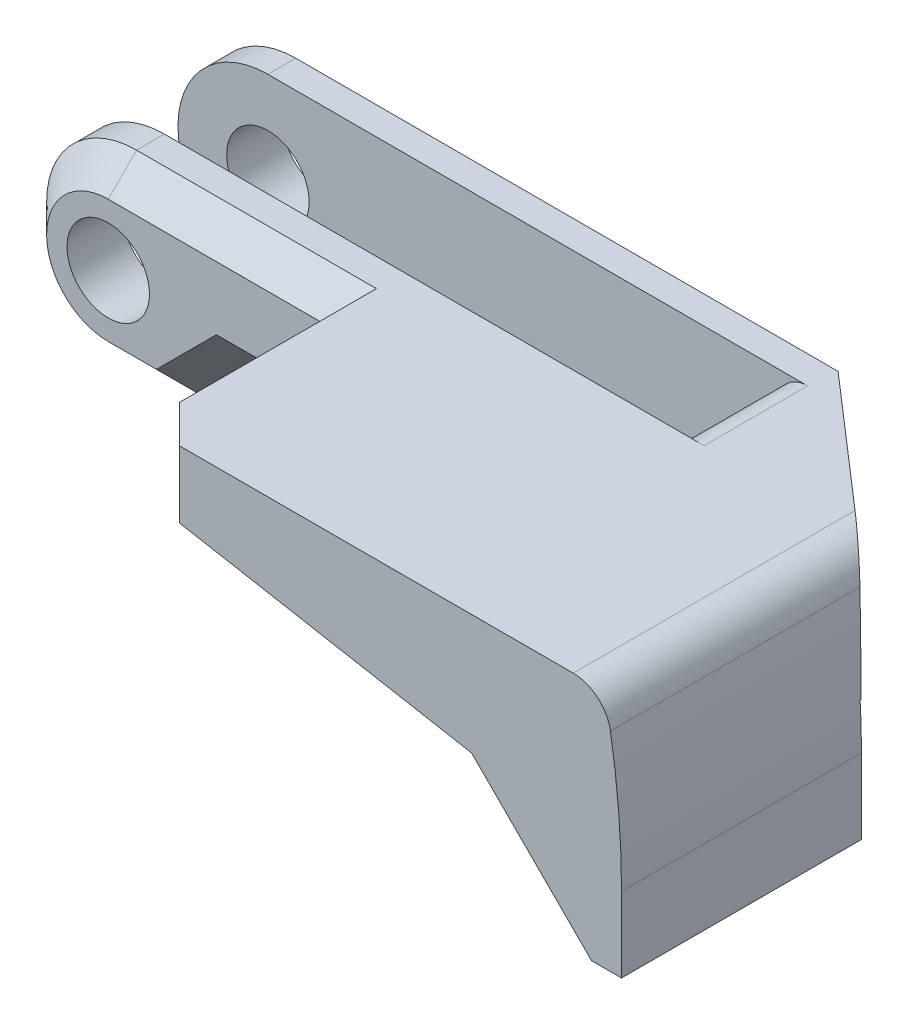
from build123d import *

# Parameters (mm, degrees)
BOSS_EXTRUDE1_DEPTH              = 11.43
BOSS_EXTRUDE2_DEPTH              = 12.7
SKETCH3_W                        = 11.43
SKETCH3_H                        = 6.35
CUT_EXTRUDE1_DEPTH               = 12.7
F_11_64_0_17188_DIAMETER_HOLE1_D = 4.365752
FILLET5_R                        = 2
BOSS_EXTRUDE3_START              = 1.778
BOSS_EXTRUDE3_DEPTH              = 1.778
CUT_EXTRUDE8_DEPTH               = 41.937805342
CUT_EXTRUDE9_DEPTH               = 1.778
CUT_EXTRUDE10_DEPTH              = 46.962070275
SKETCH16_W                       = 31.75
SKETCH16_H                       = 5.48
CUT_EXTRUDE11_DEPTH              = 46.962070275
FILLET7_R                        = 1.5875
F_1_8_0_125_DIAMETER_HOLE1_D     = 3.175
F_1_8_0_125_DIAMETER_HOLE1_DEPTH = 19.05
F_1_8_0_125_DIAMETER_HOLE1_TIP   = 0.953866233
CHAMFER6_SIZE                    = 2


with BuildPart() as part:
    # Sketch1 → Boss-Extrude1 (new body)
    with BuildSketch(Plane.XY):
        with BuildLine():
            Line((0, -4.7625), (3.175, -4.7625))
            Line((3.175, -4.7625), (6.35, -1.5875))
            Line((6.35, -1.5875), (30.1625, -1.5875))
            Line((30.1625, -1.5875), (36.5125, -7.9375))
            Line((36.5125, -7.9375), (38.1, -7.9375))
            Line((38.1, -7.9375), (38.1, 4.7625))
            Line((38.1, 4.7625), (0, 4.7625))
            ThreePointArc((0, 4.7625), (-4.7625, 0), (0, -4.7625))
        make_face()
    extrude(amount=BOSS_EXTRUDE1_DEPTH)

    # Sketch2 → Boss-Extrude2 (add)
    with BuildSketch(Plane.XY.offset(11.43)):
        with BuildLine():
            ThreePointArc((38.1, -3.96875), (37.874729062, 0.419940487), (37.201284144, 4.7625))
            Line((37.201284144, 4.7625), (12.7, 4.7625))
            Line((12.7, 4.7625), (12.7, 1.5875))
            Line((12.7, 1.5875), (30.1625, -1.5875))
            Line((30.1625, -1.5875), (36.5125, -7.9375))
            Line((36.5125, -7.9375), (38.1, -7.9375))
            Line((38.1, -7.9375), (38.1, -3.96875))
        make_face()
    extrude(amount=BOSS_EXTRUDE2_DEPTH)

    # Sketch3 → Cut-Extrude1 (cut)
    with BuildSketch(Plane(origin=(38.1, 0, 0), x_dir=(0, 0, -1), z_dir=(1, 0, 0))):
        with Locations((-5.715, -4.7625)):
            Rectangle(SKETCH3_W, SKETCH3_H)
    extrude(amount=-CUT_EXTRUDE1_DEPTH, mode=Mode.SUBTRACT)

    # 11/64 (0.17188) Diameter Hole1 (through all)
    with Locations(Plane.XY.offset(11.43)):
        with Locations((0, 0)):
            Hole(F_11_64_0_17188_DIAMETER_HOLE1_D / 2)

    # Fillet5
    fillet5_edges = [part.edges().sort_by_distance(p)[0] for p in [
        (37.201284144, 4.7625, 17.78),
    ]]
    fillet(fillet5_edges, radius=FILLET5_R)

    # Chamfer5
    # the kernel refuses this chamfer: 1.5 mm, written as the material it takes off along each edge
    with BuildSketch(Plane(origin=(0.44731828, -7.49018172, 11.43), x_dir=(0.019442520806014003, -0.019442520806014, -0.9996219169112968), z_dir=(0.7071067811865475, 0.7071067811865477, 0))) as chamfer5_piece_1_section:
        with BuildLine():
            Line((1.543009793, 0), (-0.084820732, 1.54067669))
            Line((-0.084820732, 1.54067669), (-0.11480939, 1.539851814))
            ThreePointArc((-0.11480939, 1.539851814), (-0.051193841, 0.770096744), (-0.029988658, -0.000824876))
            Line((-0.029988658, -0.000824876), (0.000824876, -0.029988658))
            ThreePointArc((0.000824876, -0.029988658), (0.771746497, -0.008783474), (1.543834669, -0.029988658))
            Line((1.543834669, -0.029988658), (1.543009793, 0))
        make_face()
    chamfer5_piece_1 = extrude(amount=12.205177024, mode=Mode.PRIVATE)
    chamfer5_piece_1 = split(chamfer5_piece_1, bisect_by=Plane(origin=(4.06290207, -1.5875, 10.93530956), z_dir=(0, -1, 0)), keep=Keep.TOP, mode=Mode.PRIVATE)
    chamfer5_piece_1 = split(chamfer5_piece_1, bisect_by=Plane(origin=(4.06290207, -4.7625, 10.93530956), z_dir=(0, 1, 0)), keep=Keep.TOP, mode=Mode.PRIVATE)
    add(chamfer5_piece_1, mode=Mode.SUBTRACT)
    with BuildSketch(Plane(origin=(0, -4.7625, 0), x_dir=(0, -0.027495876610586202, 0.9996219169112968), z_dir=(1, 0, 0))) as chamfer5_piece_2_section:
        with BuildLine():
            Line((1.543009793, 0), (-0.084820732, -1.54067669))
            Line((-0.084820732, -1.54067669), (-0.11480939, -1.539851814))
            ThreePointArc((-0.11480939, -1.539851814), (-0.051193841, -0.770096744), (-0.029988658, 0.000824876))
            Line((-0.029988658, 0.000824876), (0.000824876, 0.029988658))
            ThreePointArc((0.000824876, 0.029988658), (0.771746497, 0.008783474), (1.543834669, 0.029988658))
            Line((1.543834669, 0.029988658), (1.543009793, 0))
        make_face()
    chamfer5_piece_2 = extrude(amount=7.032524482, mode=Mode.PRIVATE)
    chamfer5_piece_2 = split(chamfer5_piece_2, bisect_by=Plane(origin=(2.781469351, -5.156030649, 0.473875429), z_dir=(-0.7071067811865477, 0.7071067811865475, 0)), keep=Keep.TOP, mode=Mode.PRIVATE)
    add(chamfer5_piece_2, mode=Mode.SUBTRACT)
    with BuildSketch(Plane(origin=(0, 0, 0), x_dir=(0, 1, 0), z_dir=(1, 0, 0))) as chamfer5_piece_3:
        with BuildLine():
            Line((3.220073593, -0.042426407), (4.804926407, 1.542426407))
            Line((4.804926407, 1.542426407), (4.834926407, 1.542426407))
            ThreePointArc((4.834926407, 1.542426407), (4.7925, 0.771213203), (4.7925, 0))
            Line((4.7925, 0), (4.7625, -0.03))
            ThreePointArc((4.7625, -0.03), (3.991286797, -0.03), (3.220073593, -0.072426407))
            Line((3.220073593, -0.072426407), (3.220073593, -0.042426407))
        make_face()
    revolve(axis=Axis((0, 0, 0), (0, 0, 1)), revolution_arc=180, mode=Mode.SUBTRACT)
    with BuildSketch(Plane(origin=(2.492475518, -1.5875, 11.43), x_dir=(0, -0.027495876610586334, -0.9996219169112968), z_dir=(1, 0, 0))) as chamfer5_piece_4_section:
        with BuildLine():
            Line((1.543009793, 0), (-0.084820732, 1.54067669))
            Line((-0.084820732, 1.54067669), (-0.11480939, 1.539851814))
            ThreePointArc((-0.11480939, 1.539851814), (-0.051193841, 0.770096744), (-0.029988658, -0.000824876))
            Line((-0.029988658, -0.000824876), (0.000824876, -0.029988658))
            ThreePointArc((0.000824876, -0.029988658), (0.771746497, -0.008783474), (1.543834669, -0.029988658))
            Line((1.543834669, -0.029988658), (1.543009793, 0))
        make_face()
    chamfer5_piece_4 = extrude(amount=31.527548964, mode=Mode.PRIVATE)
    chamfer5_piece_4 = split(chamfer5_piece_4, bisect_by=Plane(origin=(17.615702577, 0.693735895, 10.888791896), z_dir=(-0.178885438199983, -0.9838699100999075, 0)), keep=Keep.TOP, mode=Mode.PRIVATE)
    chamfer5_piece_4 = split(chamfer5_piece_4, bisect_by=Plane(origin=(17.279834664, -1.153537628, 11.43), z_dir=(0, 0, -1)), keep=Keep.TOP, mode=Mode.PRIVATE)
    chamfer5_piece_4 = split(chamfer5_piece_4, bisect_by=Plane(origin=(12.031898518, 4.094398518, 10.888791896), z_dir=(0.7071067811865477, -0.7071067811865475, 0)), keep=Keep.TOP, mode=Mode.PRIVATE)
    add(chamfer5_piece_4, mode=Mode.SUBTRACT)
    with BuildSketch(Plane(origin=(12.7, 4.7625, 11.43), x_dir=(0, 0.02749587661058619, -0.9996219169112968), z_dir=(-1, 0, 0))) as chamfer5_piece_5:
        with BuildLine():
            Line((1.543009793, 0), (-0.084820732, 1.54067669))
            Line((-0.084820732, 1.54067669), (-0.11480939, 1.539851814))
            ThreePointArc((-0.11480939, 1.539851814), (-0.051193841, 0.770096744), (-0.029988658, -0.000824876))
            Line((-0.029988658, -0.000824876), (0.000824876, -0.029988658))
            ThreePointArc((0.000824876, -0.029988658), (0.771746497, -0.008783474), (1.543834669, -0.029988658))
            Line((1.543834669, -0.029988658), (1.543009793, 0))
        make_face()
    extrude(amount=12.7, mode=Mode.SUBTRACT)
    with BuildSketch(Plane(origin=(0, 0, 11.43), x_dir=(0, 1, 0), z_dir=(1, 0, 0))) as chamfer5_piece_6:
        with BuildLine():
            Line((4.804926407, -1.542426407), (3.220073593, 0.042426407))
            Line((3.220073593, 0.042426407), (3.220073593, 0.072426407))
            ThreePointArc((3.220073593, 0.072426407), (3.991286797, 0.03), (4.7625, 0.03))
            Line((4.7625, 0.03), (4.7925, 0))
            ThreePointArc((4.7925, 0), (4.7925, -0.771213203), (4.834926407, -1.542426407))
            Line((4.834926407, -1.542426407), (4.804926407, -1.542426407))
        make_face()
    revolve(axis=Axis((0, 0, 11.43), (0, 0, 1)), revolution_arc=180, mode=Mode.SUBTRACT)
    with BuildSketch(Plane(origin=(0, -4.7625, 11.43), x_dir=(0, -0.02749587661058619, -0.9996219169112968), z_dir=(1, 0, 0))) as chamfer5_piece_7_section:
        with BuildLine():
            Line((1.543009793, 0), (-0.084820732, 1.54067669))
            Line((-0.084820732, 1.54067669), (-0.11480939, 1.539851814))
            ThreePointArc((-0.11480939, 1.539851814), (-0.051193841, 0.770096744), (-0.029988658, -0.000824876))
            Line((-0.029988658, -0.000824876), (0.000824876, -0.029988658))
            ThreePointArc((0.000824876, -0.029988658), (0.771746497, -0.008783474), (1.543834669, -0.029988658))
            Line((1.543834669, -0.029988658), (1.543009793, 0))
        make_face()
    chamfer5_piece_7 = extrude(amount=7.032524482, mode=Mode.PRIVATE)
    chamfer5_piece_7 = split(chamfer5_piece_7, bisect_by=Plane(origin=(2.781469351, -5.156030649, 10.956124571), z_dir=(-0.7071067811865477, 0.7071067811865475, 0)), keep=Keep.TOP, mode=Mode.PRIVATE)
    add(chamfer5_piece_7, mode=Mode.SUBTRACT)
    with BuildSketch(Plane(origin=(38.1, 4.7625, 0), x_dir=(0, 0.027495876610586202, 0.9996219169112968), z_dir=(-1, 0, 0))) as chamfer5_piece_8:
        with BuildLine():
            Line((1.543009793, 0), (-0.084820732, -1.54067669))
            Line((-0.084820732, -1.54067669), (-0.11480939, -1.539851814))
            ThreePointArc((-0.11480939, -1.539851814), (-0.051193841, -0.770096744), (-0.029988658, 0.000824876))
            Line((-0.029988658, 0.000824876), (0.000824876, 0.029988658))
            ThreePointArc((0.000824876, 0.029988658), (0.771746497, 0.008783474), (1.543834669, 0.029988658))
            Line((1.543834669, 0.029988658), (1.543009793, 0))
        make_face()
    extrude(amount=38.1, mode=Mode.SUBTRACT)
    with BuildSketch(Plane(origin=(0.44731828, -7.49018172, 11.43), x_dir=(0.019442520806014003, -0.019442520806014, -0.9996219169112968), z_dir=(0.7071067811865475, 0.7071067811865477, 0))) as chamfer5_piece_9a_section:
        with BuildLine():
            Line((1.543009793, 0), (-0.084820732, 1.54067669))
            Line((-0.084820732, 1.54067669), (-0.11480939, 1.539851814))
            ThreePointArc((-0.11480939, 1.539851814), (-0.051193841, 0.770096744), (-0.029988658, -0.000824876))
            Line((-0.029988658, -0.000824876), (0.000824876, -0.029988658))
            ThreePointArc((0.000824876, -0.029988658), (0.771746497, -0.008783474), (1.543834669, -0.029988658))
            Line((1.543834669, -0.029988658), (1.543009793, 0))
        make_face()
    chamfer5_piece_9a = extrude(amount=12.205177024, mode=Mode.PRIVATE)
    chamfer5_piece_9a = split(chamfer5_piece_9a, bisect_by=Plane(origin=(1.331526221, -4.7625, 10.912595192), z_dir=(0, -1, 0)), keep=Keep.TOP, mode=Mode.PRIVATE)
    with BuildSketch(Plane(origin=(0, -4.7625, 11.43), x_dir=(0, -0.02749587661058619, -0.9996219169112968), z_dir=(1, 0, 0))) as chamfer5_piece_9b_section:
        with BuildLine():
            Line((1.543009793, 0), (-0.084820732, 1.54067669))
            Line((-0.084820732, 1.54067669), (-0.11480939, 1.539851814))
            ThreePointArc((-0.11480939, 1.539851814), (-0.051193841, 0.770096744), (-0.029988658, -0.000824876))
            Line((-0.029988658, -0.000824876), (0.000824876, -0.029988658))
            ThreePointArc((0.000824876, -0.029988658), (0.771746497, -0.008783474), (1.543834669, -0.029988658))
            Line((1.543834669, -0.029988658), (1.543009793, 0))
        make_face()
    chamfer5_piece_9b = extrude(amount=7.032524482, mode=Mode.PRIVATE)
    chamfer5_piece_9b = split(chamfer5_piece_9b, bisect_by=Plane(origin=(4.47853281, -3.45896719, 10.912595192), z_dir=(0.7071067811865477, -0.7071067811865475, 0)), keep=Keep.TOP, mode=Mode.PRIVATE)
    chamfer5_piece_9 = chamfer5_piece_9a & chamfer5_piece_9b
    add(chamfer5_piece_9, mode=Mode.SUBTRACT)
    with BuildSketch(Plane(origin=(2.492475518, -1.5875, 11.43), x_dir=(0, -0.027495876610586334, -0.9996219169112968), z_dir=(1, 0, 0))) as chamfer5_piece_10a_section:
        with BuildLine():
            Line((1.543009793, 0), (-0.084820732, 1.54067669))
            Line((-0.084820732, 1.54067669), (-0.11480939, 1.539851814))
            ThreePointArc((-0.11480939, 1.539851814), (-0.051193841, 0.770096744), (-0.029988658, -0.000824876))
            Line((-0.029988658, -0.000824876), (0.000824876, -0.029988658))
            ThreePointArc((0.000824876, -0.029988658), (0.771746497, -0.008783474), (1.543834669, -0.029988658))
            Line((1.543834669, -0.029988658), (1.543009793, 0))
        make_face()
    chamfer5_piece_10a = extrude(amount=31.527548964, mode=Mode.PRIVATE)
    chamfer5_piece_10a = split(chamfer5_piece_10a, bisect_by=Plane(origin=(4.673984199, -1.082007119, 11.43), z_dir=(0, 0, -1)), keep=Keep.TOP, mode=Mode.PRIVATE)
    chamfer5_piece_10a = split(chamfer5_piece_10a, bisect_by=Plane(origin=(5.76473854, -2.17276146, 10.926543667), z_dir=(-0.7071067811865477, 0.7071067811865475, 0)), keep=Keep.TOP, mode=Mode.PRIVATE)
    with BuildSketch(Plane(origin=(0.44731828, -7.49018172, 11.43), x_dir=(0.019442520806014003, -0.019442520806014, -0.9996219169112968), z_dir=(0.7071067811865475, 0.7071067811865477, 0))) as chamfer5_piece_10b_section:
        with BuildLine():
            Line((1.543009793, 0), (-0.084820732, 1.54067669))
            Line((-0.084820732, 1.54067669), (-0.11480939, 1.539851814))
            ThreePointArc((-0.11480939, 1.539851814), (-0.051193841, 0.770096744), (-0.029988658, -0.000824876))
            Line((-0.029988658, -0.000824876), (0.000824876, -0.029988658))
            ThreePointArc((0.000824876, -0.029988658), (0.771746497, -0.008783474), (1.543834669, -0.029988658))
            Line((1.543834669, -0.029988658), (1.543009793, 0))
        make_face()
    chamfer5_piece_10b = extrude(amount=12.205177024, mode=Mode.PRIVATE)
    chamfer5_piece_10b = split(chamfer5_piece_10b, bisect_by=Plane(origin=(7.154321547, -1.5875, 10.952860313), z_dir=(0, 1, 0)), keep=Keep.TOP, mode=Mode.PRIVATE)
    chamfer5_piece_10 = chamfer5_piece_10a & chamfer5_piece_10b
    add(chamfer5_piece_10, mode=Mode.SUBTRACT)
    with BuildSketch(Plane(origin=(2.492475518, -1.5875, 11.43), x_dir=(0, -0.027495876610586334, -0.9996219169112968), z_dir=(1, 0, 0))) as chamfer5_piece_11a_section:
        with BuildLine():
            Line((1.543009793, 0), (-0.084820732, 1.54067669))
            Line((-0.084820732, 1.54067669), (-0.11480939, 1.539851814))
            ThreePointArc((-0.11480939, 1.539851814), (-0.051193841, 0.770096744), (-0.029988658, -0.000824876))
            Line((-0.029988658, -0.000824876), (0.000824876, -0.029988658))
            ThreePointArc((0.000824876, -0.029988658), (0.771746497, -0.008783474), (1.543834669, -0.029988658))
            Line((1.543834669, -0.029988658), (1.543009793, 0))
        make_face()
    chamfer5_piece_11a = extrude(amount=31.527548964, mode=Mode.PRIVATE)
    chamfer5_piece_11a = split(chamfer5_piece_11a, bisect_by=Plane(origin=(4.893812688, -0.642350142, 11.43), z_dir=(0, 0, 1)), keep=Keep.TOP, mode=Mode.PRIVATE)
    chamfer5_piece_11a = split(chamfer5_piece_11a, bisect_by=Plane(origin=(6.094481273, -1.843018727, 11.451821906), z_dir=(-0.7071067811865477, 0.7071067811865475, 0)), keep=Keep.TOP, mode=Mode.PRIVATE)
    with BuildSketch(Plane(origin=(0.44731828, -7.49018172, 11.43), x_dir=(0.019442520806014003, -0.019442520806014, -0.9996219169112968), z_dir=(0.7071067811865475, 0.7071067811865477, 0))) as chamfer5_piece_11b_section:
        with BuildLine():
            Line((1.543009793, 0), (-0.084820732, 1.54067669))
            Line((-0.084820732, 1.54067669), (-0.11480939, 1.539851814))
            ThreePointArc((-0.11480939, 1.539851814), (-0.051193841, 0.770096744), (-0.029988658, -0.000824876))
            Line((-0.029988658, -0.000824876), (0.000824876, -0.029988658))
            ThreePointArc((0.000824876, -0.029988658), (0.771746497, -0.008783474), (1.543834669, -0.029988658))
            Line((1.543834669, -0.029988658), (1.543009793, 0))
        make_face()
    chamfer5_piece_11b = extrude(amount=12.205177024, mode=Mode.PRIVATE)
    chamfer5_piece_11b = split(chamfer5_piece_11b, bisect_by=Plane(origin=(7.154321547, -1.5875, 10.952860313), z_dir=(0, 1, 0)), keep=Keep.TOP, mode=Mode.PRIVATE)
    chamfer5_piece_11 = chamfer5_piece_11a & chamfer5_piece_11b
    add(chamfer5_piece_11, mode=Mode.SUBTRACT)
    with BuildSketch(Plane(origin=(2.492475518, -1.5875, 11.43), x_dir=(0, -0.027495876610586334, -0.9996219169112968), z_dir=(1, 0, 0))) as chamfer5_piece_12a_section:
        with BuildLine():
            Line((1.543009793, 0), (-0.084820732, 1.54067669))
            Line((-0.084820732, 1.54067669), (-0.11480939, 1.539851814))
            ThreePointArc((-0.11480939, 1.539851814), (-0.051193841, 0.770096744), (-0.029988658, -0.000824876))
            Line((-0.029988658, -0.000824876), (0.000824876, -0.029988658))
            ThreePointArc((0.000824876, -0.029988658), (0.771746497, -0.008783474), (1.543834669, -0.029988658))
            Line((1.543834669, -0.029988658), (1.543009793, 0))
        make_face()
    chamfer5_piece_12a = extrude(amount=31.527548964, mode=Mode.PRIVATE)
    chamfer5_piece_12a = split(chamfer5_piece_12a, bisect_by=Plane(origin=(16.694095018, 0.861300906, 11.44990258), z_dir=(-0.178885438199983, -0.9838699100999075, 0)), keep=Keep.TOP, mode=Mode.PRIVATE)
    chamfer5_piece_12a = split(chamfer5_piece_12a, bisect_by=Plane(origin=(16.398943836, -0.762030594, 11.43), z_dir=(0, 0, 1)), keep=Keep.TOP, mode=Mode.PRIVATE)
    chamfer5_piece_12a = split(chamfer5_piece_12a, bisect_by=Plane(origin=(11.787206621, 3.849706621, 11.44990258), z_dir=(0.7071067811865477, -0.7071067811865475, 0)), keep=Keep.TOP, mode=Mode.PRIVATE)
    with BuildSketch(Plane(origin=(0.44731828, -7.49018172, 11.43), x_dir=(0.019442520806014003, -0.019442520806014, -0.9996219169112968), z_dir=(0.7071067811865475, 0.7071067811865477, 0))) as chamfer5_piece_12b_section:
        with BuildLine():
            Line((1.543009793, 0), (-0.084820732, 1.54067669))
            Line((-0.084820732, 1.54067669), (-0.11480939, 1.539851814))
            ThreePointArc((-0.11480939, 1.539851814), (-0.051193841, 0.770096744), (-0.029988658, -0.000824876))
            Line((-0.029988658, -0.000824876), (0.000824876, -0.029988658))
            ThreePointArc((0.000824876, -0.029988658), (0.771746497, -0.008783474), (1.543834669, -0.029988658))
            Line((1.543834669, -0.029988658), (1.543009793, 0))
        make_face()
    chamfer5_piece_12b = extrude(amount=12.205177024, mode=Mode.PRIVATE)
    chamfer5_piece_12b = split(chamfer5_piece_12b, bisect_by=Plane(origin=(7.154321547, -1.5875, 10.952860313), z_dir=(0, 1, 0)), keep=Keep.TOP, mode=Mode.PRIVATE)
    chamfer5_piece_12 = chamfer5_piece_12a & chamfer5_piece_12b
    add(chamfer5_piece_12, mode=Mode.SUBTRACT)

    # Sketch12 → Boss-Extrude3 (add)
    with BuildSketch(Plane(origin=(0, 0, 11.43), x_dir=(-1, 0, 0), z_dir=(0, 0, -1)).offset(BOSS_EXTRUDE3_START)):
        with BuildLine():
            Line((-38.1, -7.9375), (-36.5125, -7.9375))
            Line((-36.5125, -7.9375), (-30.1625, -1.5875))
            Line((-30.1625, -1.5875), (-38.033803049, -1.5875))
            ThreePointArc((-38.033803049, -1.5875), (-38.083447566, -2.777665033), (-38.1, -3.96875))
            Line((-38.1, -3.96875), (-38.1, -7.9375))
        make_face()
    extrude(amount=-BOSS_EXTRUDE3_DEPTH)

    # Sketch14 → Cut-Extrude8 (cut, through all)
    with BuildSketch(Plane.XY.offset(11.43)):
        with BuildLine():
            Line((38.033803049, -1.5875), (38.1, -1.5875))
            Line((38.1, -1.5875), (38.1, 4.7625))
            Line((38.1, 4.7625), (35.541769993, 4.7625))
            ThreePointArc((35.541769993, 4.7625), (36.834264268, 4.288756384), (37.514447631, 3.09195855))
            ThreePointArc((37.514447631, 3.09195855), (37.838425206, 0.759365674), (38.033803049, -1.5875))
        make_face()
    extrude(amount=-CUT_EXTRUDE8_DEPTH, mode=Mode.SUBTRACT)

    # Sketch15 → Cut-Extrude9 (cut)
    with BuildSketch(Plane.XY.offset(24.13)):
        with BuildLine():
            Line((35.541769993, 4.7625), (12.7, 4.7625))
            Line((12.7, 4.7625), (12.7, 1.5875))
            Line((12.7, 1.5875), (30.1625, -1.5875))
            Line((30.1625, -1.5875), (36.5125, -7.9375))
            Line((36.5125, -7.9375), (38.1, -7.9375))
            Line((38.1, -7.9375), (38.1, -3.96875))
            ThreePointArc((38.1, -3.96875), (37.953361071, -0.426276401), (37.514447631, 3.09195855))
            ThreePointArc((37.514447631, 3.09195855), (36.834264268, 4.288756384), (35.541769993, 4.7625))
        make_face()
    extrude(amount=-CUT_EXTRUDE9_DEPTH, mode=Mode.SUBTRACT)

    # Sketch10 → Cut-Extrude10 (cut, through all)
    with BuildSketch(Plane(origin=(0, 4.7625, 0), x_dir=(1, 0, 0), z_dir=(0, 1, 0))):
        Polygon((26.9875, 0), (38.1, 0), (38.1, -9.652), align=None)
    extrude(amount=-CUT_EXTRUDE10_DEPTH, mode=Mode.SUBTRACT)

    # Sketch16 → Cut-Extrude11 (cut, through all)
    with BuildSketch(Plane(origin=(0, 4.7625, 0), x_dir=(1, 0, 0), z_dir=(0, 1, 0))):
        with Locations((11.1125, -5.715)):
            Rectangle(SKETCH16_W, SKETCH16_H)
    extrude(amount=-CUT_EXTRUDE11_DEPTH, mode=Mode.SUBTRACT)

    # Fillet7
    fillet7_edges = [part.edges().sort_by_distance(p)[0] for p in [
        (26.9875, -1.5875, 5.715),
        (26.9875, 4.7625, 5.715),
    ]]
    fillet(fillet7_edges, radius=FILLET7_R)

    # 1/8 (0.125) Diameter Hole1
    with Locations(Plane(origin=(0, 0, 1.5875), x_dir=(-1, 0, 0), z_dir=(0, 0, -1))):
        with Locations((-33.3375, 1.5875)):
            Hole(F_1_8_0_125_DIAMETER_HOLE1_D / 2, depth=F_1_8_0_125_DIAMETER_HOLE1_DEPTH)
            with Locations((0, 0, -(F_1_8_0_125_DIAMETER_HOLE1_DEPTH + F_1_8_0_125_DIAMETER_HOLE1_TIP / 2))):  # 118° drill point
                Cone(0, F_1_8_0_125_DIAMETER_HOLE1_D / 2, F_1_8_0_125_DIAMETER_HOLE1_TIP, mode=Mode.SUBTRACT)

    # Chamfer6
    chamfer6_edges = [part.edges().sort_by_distance(p)[0] for p in [
        (12.7, 3.175, 22.352),
    ]]
    chamfer(chamfer6_edges, length=CHAMFER6_SIZE)


solid = part.part
